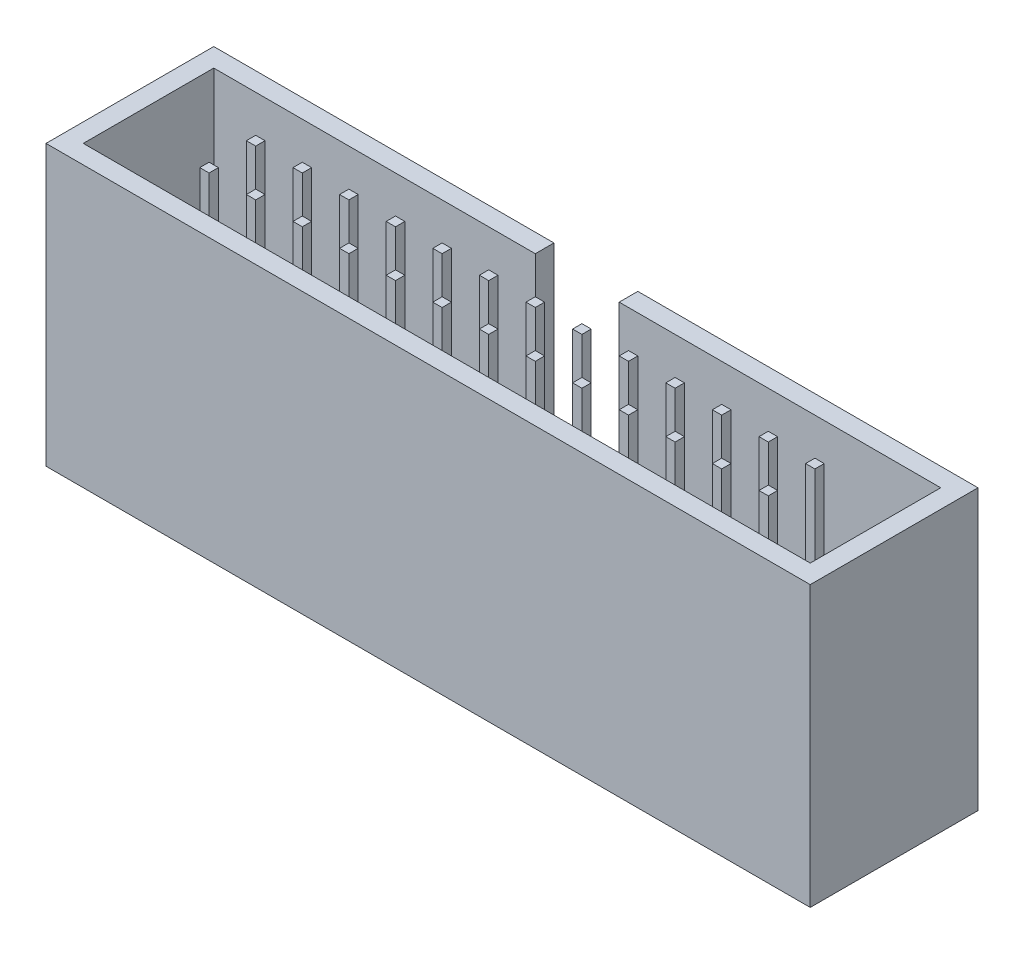
from build123d import *

# Parameters (mm, degrees)
SKETCH_499_W             = 41
SKETCH_499_H             = 9
EXTRUDE_789_DEPTH        = 15
CUT_EXTRUDE_START        = 15
SKETCH_4_W               = 39
SKETCH_4_H               = 7
CUT_EXTRUDE_8_DEPTH      = 10
SKETCH_5_W               = 4.5
SKETCH_5_H               = 6.901015062
CUT_EXTRUDE_9_DEPTH      = 10
SKETCH_6_W               = 0.5
SKETCH_6_H               = 0.5
EXTRUDE1_DEPTH           = 10
LPATTERN1_COUNT          = 7
LPATTERN1_PITCH          = 2.5
LPATTERN1_COUNT_DIR2     = 7
LPATTERN1_PITCH_DIR2     = 2.5
MIRROR1_COPY_1_SKETCH_W  = 0.5
MIRROR1_COPY_1_SKETCH_H  = 0.5
MIRROR1_COPY_1_DEPTH     = 10
MIRROR1_COPY_2_SKETCH_W  = 0.5
MIRROR1_COPY_2_SKETCH_H  = 0.5
MIRROR1_COPY_2_DEPTH     = 10
MIRROR1_COPY_3_SKETCH_W  = 0.5
MIRROR1_COPY_3_SKETCH_H  = 0.5
MIRROR1_COPY_3_DEPTH     = 10
MIRROR1_COPY_4_SKETCH_W  = 0.5
MIRROR1_COPY_4_SKETCH_H  = 0.5
MIRROR1_COPY_4_DEPTH     = 10
MIRROR1_COPY_5_SKETCH_W  = 0.5
MIRROR1_COPY_5_SKETCH_H  = 0.5
MIRROR1_COPY_5_DEPTH     = 10
MIRROR1_COPY_6_SKETCH_W  = 0.5
MIRROR1_COPY_6_SKETCH_H  = 0.5
MIRROR1_COPY_6_DEPTH     = 10
MIRROR1_COPY_7_SKETCH_W  = 0.5
MIRROR1_COPY_7_SKETCH_H  = 0.5
MIRROR1_COPY_7_DEPTH     = 10
MIRROR1_COPY_8_SKETCH_W  = 0.5
MIRROR1_COPY_8_SKETCH_H  = 0.5
MIRROR1_COPY_8_DEPTH     = 10
MIRROR1_COPY_9_SKETCH_W  = 0.5
MIRROR1_COPY_9_SKETCH_H  = 0.5
MIRROR1_COPY_9_DEPTH     = 10
MIRROR1_COPY_10_SKETCH_W = 0.5
MIRROR1_COPY_10_SKETCH_H = 0.5
MIRROR1_COPY_10_DEPTH    = 10
MIRROR1_COPY_11_SKETCH_W = 0.5
MIRROR1_COPY_11_SKETCH_H = 0.5
MIRROR1_COPY_11_DEPTH    = 10
MIRROR1_COPY_12_SKETCH_W = 0.5
MIRROR1_COPY_12_SKETCH_H = 0.5
MIRROR1_COPY_12_DEPTH    = 10
MIRROR1_COPY_13_SKETCH_W = 0.5
MIRROR1_COPY_13_SKETCH_H = 0.5
MIRROR1_COPY_13_DEPTH    = 10
MIRROR1_COPY_14_SKETCH_W = 0.5
MIRROR1_COPY_14_SKETCH_H = 0.5
MIRROR1_COPY_14_DEPTH    = 10
MIRROR1_COPY_15_SKETCH_W = 0.5
MIRROR1_COPY_15_SKETCH_H = 0.5
MIRROR1_COPY_15_DEPTH    = 10
MIRROR1_COPY_16_SKETCH_W = 0.5
MIRROR1_COPY_16_SKETCH_H = 0.5
MIRROR1_COPY_16_DEPTH    = 10
MIRROR1_COPY_17_SKETCH_W = 0.5
MIRROR1_COPY_17_SKETCH_H = 0.5
MIRROR1_COPY_17_DEPTH    = 10
MIRROR1_COPY_18_SKETCH_W = 0.5
MIRROR1_COPY_18_SKETCH_H = 0.5
MIRROR1_COPY_18_DEPTH    = 10
MIRROR1_COPY_19_SKETCH_W = 0.5
MIRROR1_COPY_19_SKETCH_H = 0.5
MIRROR1_COPY_19_DEPTH    = 10
MIRROR1_COPY_20_SKETCH_W = 0.5
MIRROR1_COPY_20_SKETCH_H = 0.5
MIRROR1_COPY_20_DEPTH    = 10
MIRROR1_COPY_21_SKETCH_W = 0.5
MIRROR1_COPY_21_SKETCH_H = 0.5
MIRROR1_COPY_21_DEPTH    = 10
MIRROR1_COPY_22_SKETCH_W = 0.5
MIRROR1_COPY_22_SKETCH_H = 0.5
MIRROR1_COPY_22_DEPTH    = 10
MIRROR1_COPY_23_SKETCH_W = 0.5
MIRROR1_COPY_23_SKETCH_H = 0.5
MIRROR1_COPY_23_DEPTH    = 10
MIRROR1_COPY_24_SKETCH_W = 0.5
MIRROR1_COPY_24_SKETCH_H = 0.5
MIRROR1_COPY_24_DEPTH    = 10
MIRROR1_COPY_25_SKETCH_W = 0.5
MIRROR1_COPY_25_SKETCH_H = 0.5
MIRROR1_COPY_25_DEPTH    = 10
MIRROR1_COPY_26_SKETCH_W = 0.5
MIRROR1_COPY_26_SKETCH_H = 0.5
MIRROR1_COPY_26_DEPTH    = 10
MIRROR1_COPY_27_SKETCH_W = 0.5
MIRROR1_COPY_27_SKETCH_H = 0.5
MIRROR1_COPY_27_DEPTH    = 10
MIRROR1_COPY_28_SKETCH_W = 0.5
MIRROR1_COPY_28_SKETCH_H = 0.5
MIRROR1_COPY_28_DEPTH    = 10
MIRROR1_COPY_29_SKETCH_W = 0.5
MIRROR1_COPY_29_SKETCH_H = 0.5
MIRROR1_COPY_29_DEPTH    = 10
MIRROR1_COPY_30_SKETCH_W = 0.5
MIRROR1_COPY_30_SKETCH_H = 0.5
MIRROR1_COPY_30_DEPTH    = 10
MIRROR1_COPY_31_SKETCH_W = 0.5
MIRROR1_COPY_31_SKETCH_H = 0.5
MIRROR1_COPY_31_DEPTH    = 10
MIRROR1_COPY_32_SKETCH_W = 0.5
MIRROR1_COPY_32_SKETCH_H = 0.5
MIRROR1_COPY_32_DEPTH    = 10
MIRROR1_COPY_33_SKETCH_W = 0.5
MIRROR1_COPY_33_SKETCH_H = 0.5
MIRROR1_COPY_33_DEPTH    = 10
MIRROR1_COPY_34_SKETCH_W = 0.5
MIRROR1_COPY_34_SKETCH_H = 0.5
MIRROR1_COPY_34_DEPTH    = 10
MIRROR1_COPY_35_SKETCH_W = 0.5
MIRROR1_COPY_35_SKETCH_H = 0.5
MIRROR1_COPY_35_DEPTH    = 10
MIRROR1_COPY_36_SKETCH_W = 0.5
MIRROR1_COPY_36_SKETCH_H = 0.5
MIRROR1_COPY_36_DEPTH    = 10
MIRROR1_COPY_37_SKETCH_W = 0.5
MIRROR1_COPY_37_SKETCH_H = 0.5
MIRROR1_COPY_37_DEPTH    = 10
MIRROR1_COPY_38_SKETCH_W = 0.5
MIRROR1_COPY_38_SKETCH_H = 0.5
MIRROR1_COPY_38_DEPTH    = 10
MIRROR1_COPY_39_SKETCH_W = 0.5
MIRROR1_COPY_39_SKETCH_H = 0.5
MIRROR1_COPY_39_DEPTH    = 10
MIRROR1_COPY_40_SKETCH_W = 0.5
MIRROR1_COPY_40_SKETCH_H = 0.5
MIRROR1_COPY_40_DEPTH    = 10
MIRROR1_COPY_41_SKETCH_W = 0.5
MIRROR1_COPY_41_SKETCH_H = 0.5
MIRROR1_COPY_41_DEPTH    = 10
MIRROR1_COPY_42_SKETCH_W = 0.5
MIRROR1_COPY_42_SKETCH_H = 0.5
MIRROR1_COPY_42_DEPTH    = 10
MIRROR1_COPY_43_SKETCH_W = 0.5
MIRROR1_COPY_43_SKETCH_H = 0.5
MIRROR1_COPY_43_DEPTH    = 10
MIRROR1_COPY_44_SKETCH_W = 0.5
MIRROR1_COPY_44_SKETCH_H = 0.5
MIRROR1_COPY_44_DEPTH    = 10
MIRROR1_COPY_45_SKETCH_W = 0.5
MIRROR1_COPY_45_SKETCH_H = 0.5
MIRROR1_COPY_45_DEPTH    = 10
MIRROR1_COPY_46_SKETCH_W = 0.5
MIRROR1_COPY_46_SKETCH_H = 0.5
MIRROR1_COPY_46_DEPTH    = 10
MIRROR1_COPY_47_SKETCH_W = 0.5
MIRROR1_COPY_47_SKETCH_H = 0.5
MIRROR1_COPY_47_DEPTH    = 10
MIRROR1_COPY_48_SKETCH_W = 0.5
MIRROR1_COPY_48_SKETCH_H = 0.5
MIRROR1_COPY_48_DEPTH    = 10
MIRROR1_COPY_49_SKETCH_W = 0.5
MIRROR1_COPY_49_SKETCH_H = 0.5
MIRROR1_COPY_49_DEPTH    = 10


with BuildPart() as part:
    # Sketch 499 → Extrude 789 (new body)
    with BuildSketch(Plane(origin=(0, 0, 0), x_dir=(1, 0, 0), z_dir=(0, 1, 0))):
        Rectangle(SKETCH_499_W, SKETCH_499_H)
    extrude(amount=EXTRUDE_789_DEPTH)

    # 草图4 → 切除-拉伸8 (cut)
    with BuildSketch(Plane(origin=(0, 0, 0), x_dir=(1, 0, 0), z_dir=(0, 1, 0)).offset(CUT_EXTRUDE_START)):
        Rectangle(SKETCH_4_W, SKETCH_4_H)
    extrude(amount=-CUT_EXTRUDE_8_DEPTH, mode=Mode.SUBTRACT)

    # 草图5 → 切除-拉伸9 (cut)
    with BuildSketch(Plane(origin=(0, 15, 0), x_dir=(1, 0, 0), z_dir=(0, 1, 0))):
        with Locations((0, 3.450507531)):
            Rectangle(SKETCH_5_W, SKETCH_5_H)
    extrude(amount=-CUT_EXTRUDE_9_DEPTH, mode=Mode.SUBTRACT)

    # 草图6 → Extrude1 (add)
    with BuildSketch(Plane(origin=(0, 5, 0), x_dir=(1, 0, 0), z_dir=(0, 1, 0))):
        with Locations((0, 1.25)):
            Rectangle(SKETCH_6_W, SKETCH_6_H)
    extrude1 = extrude(amount=EXTRUDE1_DEPTH)

    # LPattern1: Extrude1 7 × 7
    with Locations(*[Vector(1, 0, 0) * (i * LPATTERN1_PITCH) + Vector(-1, 0, 0) * (j * LPATTERN1_PITCH_DIR2) for i in range(LPATTERN1_COUNT) for j in range(LPATTERN1_COUNT_DIR2) if (i, j) != (0, 0)]):
        add(extrude1)

    # Mirror1 copy 1 sketch → Mirror1 copy 1 (add)
    with BuildSketch(Plane(origin=(-2.5, 5, 0), x_dir=(1, 0, 0), z_dir=(0, 1, 0))):
        with Locations((0, -1.25)):
            Rectangle(MIRROR1_COPY_1_SKETCH_W, MIRROR1_COPY_1_SKETCH_H)
    extrude(amount=MIRROR1_COPY_1_DEPTH)

    # Mirror1 copy 2 sketch → Mirror1 copy 2 (add)
    with BuildSketch(Plane(origin=(-5, 5, 0), x_dir=(1, 0, 0), z_dir=(0, 1, 0))):
        with Locations((0, -1.25)):
            Rectangle(MIRROR1_COPY_2_SKETCH_W, MIRROR1_COPY_2_SKETCH_H)
    extrude(amount=MIRROR1_COPY_2_DEPTH)

    # Mirror1 copy 3 sketch → Mirror1 copy 3 (add)
    with BuildSketch(Plane(origin=(-7.5, 5, 0), x_dir=(1, 0, 0), z_dir=(0, 1, 0))):
        with Locations((0, -1.25)):
            Rectangle(MIRROR1_COPY_3_SKETCH_W, MIRROR1_COPY_3_SKETCH_H)
    extrude(amount=MIRROR1_COPY_3_DEPTH)

    # Mirror1 copy 4 sketch → Mirror1 copy 4 (add)
    with BuildSketch(Plane(origin=(-10, 5, 0), x_dir=(1, 0, 0), z_dir=(0, 1, 0))):
        with Locations((0, -1.25)):
            Rectangle(MIRROR1_COPY_4_SKETCH_W, MIRROR1_COPY_4_SKETCH_H)
    extrude(amount=MIRROR1_COPY_4_DEPTH)

    # Mirror1 copy 5 sketch → Mirror1 copy 5 (add)
    with BuildSketch(Plane(origin=(-12.5, 5, 0), x_dir=(1, 0, 0), z_dir=(0, 1, 0))):
        with Locations((0, -1.25)):
            Rectangle(MIRROR1_COPY_5_SKETCH_W, MIRROR1_COPY_5_SKETCH_H)
    extrude(amount=MIRROR1_COPY_5_DEPTH)

    # Mirror1 copy 6 sketch → Mirror1 copy 6 (add)
    with BuildSketch(Plane(origin=(-15, 5, 0), x_dir=(1, 0, 0), z_dir=(0, 1, 0))):
        with Locations((0, -1.25)):
            Rectangle(MIRROR1_COPY_6_SKETCH_W, MIRROR1_COPY_6_SKETCH_H)
    extrude(amount=MIRROR1_COPY_6_DEPTH)

    # Mirror1 copy 7 sketch → Mirror1 copy 7 (add)
    with BuildSketch(Plane(origin=(2.5, 5, 0), x_dir=(1, 0, 0), z_dir=(0, 1, 0))):
        with Locations((0, -1.25)):
            Rectangle(MIRROR1_COPY_7_SKETCH_W, MIRROR1_COPY_7_SKETCH_H)
    extrude(amount=MIRROR1_COPY_7_DEPTH)

    # Mirror1 copy 8 sketch → Mirror1 copy 8 (add)
    with BuildSketch(Plane(origin=(0, 5, 0), x_dir=(1, 0, 0), z_dir=(0, 1, 0))):
        with Locations((0, -1.25)):
            Rectangle(MIRROR1_COPY_8_SKETCH_W, MIRROR1_COPY_8_SKETCH_H)
    extrude(amount=MIRROR1_COPY_8_DEPTH)

    # Mirror1 copy 9 sketch → Mirror1 copy 9 (add)
    with BuildSketch(Plane(origin=(-2.5, 5, 0), x_dir=(1, 0, 0), z_dir=(0, 1, 0))):
        with Locations((0, -1.25)):
            Rectangle(MIRROR1_COPY_9_SKETCH_W, MIRROR1_COPY_9_SKETCH_H)
    extrude(amount=MIRROR1_COPY_9_DEPTH)

    # Mirror1 copy 10 sketch → Mirror1 copy 10 (add)
    with BuildSketch(Plane(origin=(-5, 5, 0), x_dir=(1, 0, 0), z_dir=(0, 1, 0))):
        with Locations((0, -1.25)):
            Rectangle(MIRROR1_COPY_10_SKETCH_W, MIRROR1_COPY_10_SKETCH_H)
    extrude(amount=MIRROR1_COPY_10_DEPTH)

    # Mirror1 copy 11 sketch → Mirror1 copy 11 (add)
    with BuildSketch(Plane(origin=(-7.5, 5, 0), x_dir=(1, 0, 0), z_dir=(0, 1, 0))):
        with Locations((0, -1.25)):
            Rectangle(MIRROR1_COPY_11_SKETCH_W, MIRROR1_COPY_11_SKETCH_H)
    extrude(amount=MIRROR1_COPY_11_DEPTH)

    # Mirror1 copy 12 sketch → Mirror1 copy 12 (add)
    with BuildSketch(Plane(origin=(-10, 5, 0), x_dir=(1, 0, 0), z_dir=(0, 1, 0))):
        with Locations((0, -1.25)):
            Rectangle(MIRROR1_COPY_12_SKETCH_W, MIRROR1_COPY_12_SKETCH_H)
    extrude(amount=MIRROR1_COPY_12_DEPTH)

    # Mirror1 copy 13 sketch → Mirror1 copy 13 (add)
    with BuildSketch(Plane(origin=(-12.5, 5, 0), x_dir=(1, 0, 0), z_dir=(0, 1, 0))):
        with Locations((0, -1.25)):
            Rectangle(MIRROR1_COPY_13_SKETCH_W, MIRROR1_COPY_13_SKETCH_H)
    extrude(amount=MIRROR1_COPY_13_DEPTH)

    # Mirror1 copy 14 sketch → Mirror1 copy 14 (add)
    with BuildSketch(Plane(origin=(5, 5, 0), x_dir=(1, 0, 0), z_dir=(0, 1, 0))):
        with Locations((0, -1.25)):
            Rectangle(MIRROR1_COPY_14_SKETCH_W, MIRROR1_COPY_14_SKETCH_H)
    extrude(amount=MIRROR1_COPY_14_DEPTH)

    # Mirror1 copy 15 sketch → Mirror1 copy 15 (add)
    with BuildSketch(Plane(origin=(2.5, 5, 0), x_dir=(1, 0, 0), z_dir=(0, 1, 0))):
        with Locations((0, -1.25)):
            Rectangle(MIRROR1_COPY_15_SKETCH_W, MIRROR1_COPY_15_SKETCH_H)
    extrude(amount=MIRROR1_COPY_15_DEPTH)

    # Mirror1 copy 16 sketch → Mirror1 copy 16 (add)
    with BuildSketch(Plane(origin=(0, 5, 0), x_dir=(1, 0, 0), z_dir=(0, 1, 0))):
        with Locations((0, -1.25)):
            Rectangle(MIRROR1_COPY_16_SKETCH_W, MIRROR1_COPY_16_SKETCH_H)
    extrude(amount=MIRROR1_COPY_16_DEPTH)

    # Mirror1 copy 17 sketch → Mirror1 copy 17 (add)
    with BuildSketch(Plane(origin=(-2.5, 5, 0), x_dir=(1, 0, 0), z_dir=(0, 1, 0))):
        with Locations((0, -1.25)):
            Rectangle(MIRROR1_COPY_17_SKETCH_W, MIRROR1_COPY_17_SKETCH_H)
    extrude(amount=MIRROR1_COPY_17_DEPTH)

    # Mirror1 copy 18 sketch → Mirror1 copy 18 (add)
    with BuildSketch(Plane(origin=(-5, 5, 0), x_dir=(1, 0, 0), z_dir=(0, 1, 0))):
        with Locations((0, -1.25)):
            Rectangle(MIRROR1_COPY_18_SKETCH_W, MIRROR1_COPY_18_SKETCH_H)
    extrude(amount=MIRROR1_COPY_18_DEPTH)

    # Mirror1 copy 19 sketch → Mirror1 copy 19 (add)
    with BuildSketch(Plane(origin=(-7.5, 5, 0), x_dir=(1, 0, 0), z_dir=(0, 1, 0))):
        with Locations((0, -1.25)):
            Rectangle(MIRROR1_COPY_19_SKETCH_W, MIRROR1_COPY_19_SKETCH_H)
    extrude(amount=MIRROR1_COPY_19_DEPTH)

    # Mirror1 copy 20 sketch → Mirror1 copy 20 (add)
    with BuildSketch(Plane(origin=(-10, 5, 0), x_dir=(1, 0, 0), z_dir=(0, 1, 0))):
        with Locations((0, -1.25)):
            Rectangle(MIRROR1_COPY_20_SKETCH_W, MIRROR1_COPY_20_SKETCH_H)
    extrude(amount=MIRROR1_COPY_20_DEPTH)

    # Mirror1 copy 21 sketch → Mirror1 copy 21 (add)
    with BuildSketch(Plane(origin=(7.5, 5, 0), x_dir=(1, 0, 0), z_dir=(0, 1, 0))):
        with Locations((0, -1.25)):
            Rectangle(MIRROR1_COPY_21_SKETCH_W, MIRROR1_COPY_21_SKETCH_H)
    extrude(amount=MIRROR1_COPY_21_DEPTH)

    # Mirror1 copy 22 sketch → Mirror1 copy 22 (add)
    with BuildSketch(Plane(origin=(5, 5, 0), x_dir=(1, 0, 0), z_dir=(0, 1, 0))):
        with Locations((0, -1.25)):
            Rectangle(MIRROR1_COPY_22_SKETCH_W, MIRROR1_COPY_22_SKETCH_H)
    extrude(amount=MIRROR1_COPY_22_DEPTH)

    # Mirror1 copy 23 sketch → Mirror1 copy 23 (add)
    with BuildSketch(Plane(origin=(2.5, 5, 0), x_dir=(1, 0, 0), z_dir=(0, 1, 0))):
        with Locations((0, -1.25)):
            Rectangle(MIRROR1_COPY_23_SKETCH_W, MIRROR1_COPY_23_SKETCH_H)
    extrude(amount=MIRROR1_COPY_23_DEPTH)

    # Mirror1 copy 24 sketch → Mirror1 copy 24 (add)
    with BuildSketch(Plane(origin=(0, 5, 0), x_dir=(1, 0, 0), z_dir=(0, 1, 0))):
        with Locations((0, -1.25)):
            Rectangle(MIRROR1_COPY_24_SKETCH_W, MIRROR1_COPY_24_SKETCH_H)
    extrude(amount=MIRROR1_COPY_24_DEPTH)

    # Mirror1 copy 25 sketch → Mirror1 copy 25 (add)
    with BuildSketch(Plane(origin=(-2.5, 5, 0), x_dir=(1, 0, 0), z_dir=(0, 1, 0))):
        with Locations((0, -1.25)):
            Rectangle(MIRROR1_COPY_25_SKETCH_W, MIRROR1_COPY_25_SKETCH_H)
    extrude(amount=MIRROR1_COPY_25_DEPTH)

    # Mirror1 copy 26 sketch → Mirror1 copy 26 (add)
    with BuildSketch(Plane(origin=(-5, 5, 0), x_dir=(1, 0, 0), z_dir=(0, 1, 0))):
        with Locations((0, -1.25)):
            Rectangle(MIRROR1_COPY_26_SKETCH_W, MIRROR1_COPY_26_SKETCH_H)
    extrude(amount=MIRROR1_COPY_26_DEPTH)

    # Mirror1 copy 27 sketch → Mirror1 copy 27 (add)
    with BuildSketch(Plane(origin=(-7.5, 5, 0), x_dir=(1, 0, 0), z_dir=(0, 1, 0))):
        with Locations((0, -1.25)):
            Rectangle(MIRROR1_COPY_27_SKETCH_W, MIRROR1_COPY_27_SKETCH_H)
    extrude(amount=MIRROR1_COPY_27_DEPTH)

    # Mirror1 copy 28 sketch → Mirror1 copy 28 (add)
    with BuildSketch(Plane(origin=(10, 5, 0), x_dir=(1, 0, 0), z_dir=(0, 1, 0))):
        with Locations((0, -1.25)):
            Rectangle(MIRROR1_COPY_28_SKETCH_W, MIRROR1_COPY_28_SKETCH_H)
    extrude(amount=MIRROR1_COPY_28_DEPTH)

    # Mirror1 copy 29 sketch → Mirror1 copy 29 (add)
    with BuildSketch(Plane(origin=(7.5, 5, 0), x_dir=(1, 0, 0), z_dir=(0, 1, 0))):
        with Locations((0, -1.25)):
            Rectangle(MIRROR1_COPY_29_SKETCH_W, MIRROR1_COPY_29_SKETCH_H)
    extrude(amount=MIRROR1_COPY_29_DEPTH)

    # Mirror1 copy 30 sketch → Mirror1 copy 30 (add)
    with BuildSketch(Plane(origin=(5, 5, 0), x_dir=(1, 0, 0), z_dir=(0, 1, 0))):
        with Locations((0, -1.25)):
            Rectangle(MIRROR1_COPY_30_SKETCH_W, MIRROR1_COPY_30_SKETCH_H)
    extrude(amount=MIRROR1_COPY_30_DEPTH)

    # Mirror1 copy 31 sketch → Mirror1 copy 31 (add)
    with BuildSketch(Plane(origin=(2.5, 5, 0), x_dir=(1, 0, 0), z_dir=(0, 1, 0))):
        with Locations((0, -1.25)):
            Rectangle(MIRROR1_COPY_31_SKETCH_W, MIRROR1_COPY_31_SKETCH_H)
    extrude(amount=MIRROR1_COPY_31_DEPTH)

    # Mirror1 copy 32 sketch → Mirror1 copy 32 (add)
    with BuildSketch(Plane(origin=(0, 5, 0), x_dir=(1, 0, 0), z_dir=(0, 1, 0))):
        with Locations((0, -1.25)):
            Rectangle(MIRROR1_COPY_32_SKETCH_W, MIRROR1_COPY_32_SKETCH_H)
    extrude(amount=MIRROR1_COPY_32_DEPTH)

    # Mirror1 copy 33 sketch → Mirror1 copy 33 (add)
    with BuildSketch(Plane(origin=(-2.5, 5, 0), x_dir=(1, 0, 0), z_dir=(0, 1, 0))):
        with Locations((0, -1.25)):
            Rectangle(MIRROR1_COPY_33_SKETCH_W, MIRROR1_COPY_33_SKETCH_H)
    extrude(amount=MIRROR1_COPY_33_DEPTH)

    # Mirror1 copy 34 sketch → Mirror1 copy 34 (add)
    with BuildSketch(Plane(origin=(-5, 5, 0), x_dir=(1, 0, 0), z_dir=(0, 1, 0))):
        with Locations((0, -1.25)):
            Rectangle(MIRROR1_COPY_34_SKETCH_W, MIRROR1_COPY_34_SKETCH_H)
    extrude(amount=MIRROR1_COPY_34_DEPTH)

    # Mirror1 copy 35 sketch → Mirror1 copy 35 (add)
    with BuildSketch(Plane(origin=(12.5, 5, 0), x_dir=(1, 0, 0), z_dir=(0, 1, 0))):
        with Locations((0, -1.25)):
            Rectangle(MIRROR1_COPY_35_SKETCH_W, MIRROR1_COPY_35_SKETCH_H)
    extrude(amount=MIRROR1_COPY_35_DEPTH)

    # Mirror1 copy 36 sketch → Mirror1 copy 36 (add)
    with BuildSketch(Plane(origin=(10, 5, 0), x_dir=(1, 0, 0), z_dir=(0, 1, 0))):
        with Locations((0, -1.25)):
            Rectangle(MIRROR1_COPY_36_SKETCH_W, MIRROR1_COPY_36_SKETCH_H)
    extrude(amount=MIRROR1_COPY_36_DEPTH)

    # Mirror1 copy 37 sketch → Mirror1 copy 37 (add)
    with BuildSketch(Plane(origin=(7.5, 5, 0), x_dir=(1, 0, 0), z_dir=(0, 1, 0))):
        with Locations((0, -1.25)):
            Rectangle(MIRROR1_COPY_37_SKETCH_W, MIRROR1_COPY_37_SKETCH_H)
    extrude(amount=MIRROR1_COPY_37_DEPTH)

    # Mirror1 copy 38 sketch → Mirror1 copy 38 (add)
    with BuildSketch(Plane(origin=(5, 5, 0), x_dir=(1, 0, 0), z_dir=(0, 1, 0))):
        with Locations((0, -1.25)):
            Rectangle(MIRROR1_COPY_38_SKETCH_W, MIRROR1_COPY_38_SKETCH_H)
    extrude(amount=MIRROR1_COPY_38_DEPTH)

    # Mirror1 copy 39 sketch → Mirror1 copy 39 (add)
    with BuildSketch(Plane(origin=(2.5, 5, 0), x_dir=(1, 0, 0), z_dir=(0, 1, 0))):
        with Locations((0, -1.25)):
            Rectangle(MIRROR1_COPY_39_SKETCH_W, MIRROR1_COPY_39_SKETCH_H)
    extrude(amount=MIRROR1_COPY_39_DEPTH)

    # Mirror1 copy 40 sketch → Mirror1 copy 40 (add)
    with BuildSketch(Plane(origin=(0, 5, 0), x_dir=(1, 0, 0), z_dir=(0, 1, 0))):
        with Locations((0, -1.25)):
            Rectangle(MIRROR1_COPY_40_SKETCH_W, MIRROR1_COPY_40_SKETCH_H)
    extrude(amount=MIRROR1_COPY_40_DEPTH)

    # Mirror1 copy 41 sketch → Mirror1 copy 41 (add)
    with BuildSketch(Plane(origin=(-2.5, 5, 0), x_dir=(1, 0, 0), z_dir=(0, 1, 0))):
        with Locations((0, -1.25)):
            Rectangle(MIRROR1_COPY_41_SKETCH_W, MIRROR1_COPY_41_SKETCH_H)
    extrude(amount=MIRROR1_COPY_41_DEPTH)

    # Mirror1 copy 42 sketch → Mirror1 copy 42 (add)
    with BuildSketch(Plane(origin=(15, 5, 0), x_dir=(1, 0, 0), z_dir=(0, 1, 0))):
        with Locations((0, -1.25)):
            Rectangle(MIRROR1_COPY_42_SKETCH_W, MIRROR1_COPY_42_SKETCH_H)
    extrude(amount=MIRROR1_COPY_42_DEPTH)

    # Mirror1 copy 43 sketch → Mirror1 copy 43 (add)
    with BuildSketch(Plane(origin=(12.5, 5, 0), x_dir=(1, 0, 0), z_dir=(0, 1, 0))):
        with Locations((0, -1.25)):
            Rectangle(MIRROR1_COPY_43_SKETCH_W, MIRROR1_COPY_43_SKETCH_H)
    extrude(amount=MIRROR1_COPY_43_DEPTH)

    # Mirror1 copy 44 sketch → Mirror1 copy 44 (add)
    with BuildSketch(Plane(origin=(10, 5, 0), x_dir=(1, 0, 0), z_dir=(0, 1, 0))):
        with Locations((0, -1.25)):
            Rectangle(MIRROR1_COPY_44_SKETCH_W, MIRROR1_COPY_44_SKETCH_H)
    extrude(amount=MIRROR1_COPY_44_DEPTH)

    # Mirror1 copy 45 sketch → Mirror1 copy 45 (add)
    with BuildSketch(Plane(origin=(7.5, 5, 0), x_dir=(1, 0, 0), z_dir=(0, 1, 0))):
        with Locations((0, -1.25)):
            Rectangle(MIRROR1_COPY_45_SKETCH_W, MIRROR1_COPY_45_SKETCH_H)
    extrude(amount=MIRROR1_COPY_45_DEPTH)

    # Mirror1 copy 46 sketch → Mirror1 copy 46 (add)
    with BuildSketch(Plane(origin=(5, 5, 0), x_dir=(1, 0, 0), z_dir=(0, 1, 0))):
        with Locations((0, -1.25)):
            Rectangle(MIRROR1_COPY_46_SKETCH_W, MIRROR1_COPY_46_SKETCH_H)
    extrude(amount=MIRROR1_COPY_46_DEPTH)

    # Mirror1 copy 47 sketch → Mirror1 copy 47 (add)
    with BuildSketch(Plane(origin=(2.5, 5, 0), x_dir=(1, 0, 0), z_dir=(0, 1, 0))):
        with Locations((0, -1.25)):
            Rectangle(MIRROR1_COPY_47_SKETCH_W, MIRROR1_COPY_47_SKETCH_H)
    extrude(amount=MIRROR1_COPY_47_DEPTH)

    # Mirror1 copy 48 sketch → Mirror1 copy 48 (add)
    with BuildSketch(Plane(origin=(0, 5, 0), x_dir=(1, 0, 0), z_dir=(0, 1, 0))):
        with Locations((0, -1.25)):
            Rectangle(MIRROR1_COPY_48_SKETCH_W, MIRROR1_COPY_48_SKETCH_H)
    extrude(amount=MIRROR1_COPY_48_DEPTH)

    # Mirror1 copy 49 sketch → Mirror1 copy 49 (add)
    with BuildSketch(Plane(origin=(0, 5, 0), x_dir=(1, 0, 0), z_dir=(0, 1, 0))):
        with Locations((0, -1.25)):
            Rectangle(MIRROR1_COPY_49_SKETCH_W, MIRROR1_COPY_49_SKETCH_H)
    extrude(amount=MIRROR1_COPY_49_DEPTH)


solid = part.part
